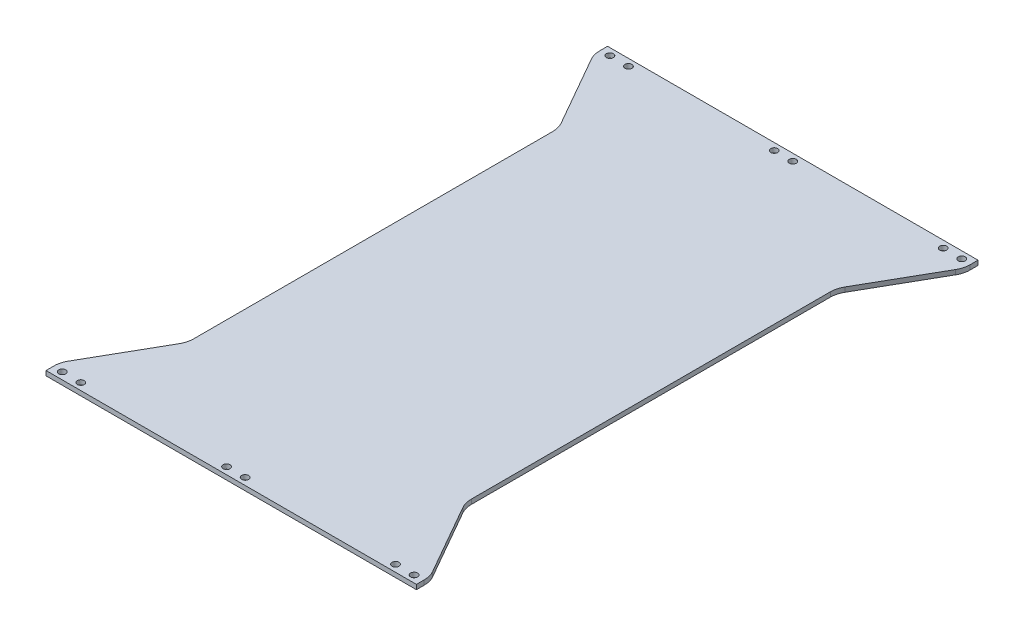
from build123d import *

# Parameters (mm, degrees)
SKETCH2_R           = 1.5
BOSS_EXTRUDE1_DEPTH = 2
FILLET1_R           = 10


with BuildPart() as part:
    # Sketch2 → Boss-Extrude1 (new body)
    with BuildSketch(Plane(origin=(0, 0, 0), x_dir=(1, 0, 0), z_dir=(0, 1, 0))):
        Polygon((688.047893911, -1476.918579287), (688.047893911, -1482.918579287), (708.047893911, -1517.918579287), (708.047893911, -1677.918579287), (688.047893911, -1712.918579287), (688.047893911, -1718.918579287), (847.682893911, -1718.918579287), (847.682893911, -1712.918579287), (827.682893911, -1677.918579287), (827.682893911, -1517.918579287), (847.682893911, -1482.918579287), (847.682893911, -1476.918579287), align=None)
        with Locations((843.682893911, -1479.918579287)):
            Circle(SKETCH2_R, mode=Mode.SUBTRACT)
        with Locations((835.682893911, -1479.918579287)):
            Circle(SKETCH2_R, mode=Mode.SUBTRACT)
        with Locations((762.867893911, -1479.918579287)):
            Circle(SKETCH2_R, mode=Mode.SUBTRACT)
        with Locations((770.867893911, -1479.918579287)):
            Circle(SKETCH2_R, mode=Mode.SUBTRACT)
        with Locations((700.047893911, -1479.918579287)):
            Circle(SKETCH2_R, mode=Mode.SUBTRACT)
        with Locations((692.047893911, -1479.918579287)):
            Circle(SKETCH2_R, mode=Mode.SUBTRACT)
        with Locations((692.047893911, -1715.918579287)):
            Circle(SKETCH2_R, mode=Mode.SUBTRACT)
        with Locations((700.047893911, -1715.918579287)):
            Circle(SKETCH2_R, mode=Mode.SUBTRACT)
        with Locations((770.867893911, -1715.918579287)):
            Circle(SKETCH2_R, mode=Mode.SUBTRACT)
        with Locations((762.867893911, -1715.918579287)):
            Circle(SKETCH2_R, mode=Mode.SUBTRACT)
        with Locations((835.682893911, -1715.918579287)):
            Circle(SKETCH2_R, mode=Mode.SUBTRACT)
        with Locations((843.682893911, -1715.918579287)):
            Circle(SKETCH2_R, mode=Mode.SUBTRACT)
    extrude(amount=BOSS_EXTRUDE1_DEPTH)

    # Fillet1
    fillet1_edges = [part.edges().sort_by_distance(p)[0] for p in [
        (708.047893911, 1, 1677.918579287),
        (688.047893911, 1, 1712.918579287),
        (847.682893911, 1, 1712.918579287),
        (827.682893911, 1, 1677.918579287),
        (847.682893911, 1, 1482.918579287),
        (827.682893911, 1, 1517.918579287),
        (688.047893911, 1, 1482.918579287),
        (708.047893911, 1, 1517.918579287),
    ]]
    fillet(fillet1_edges, radius=FILLET1_R)


solid = part.part
